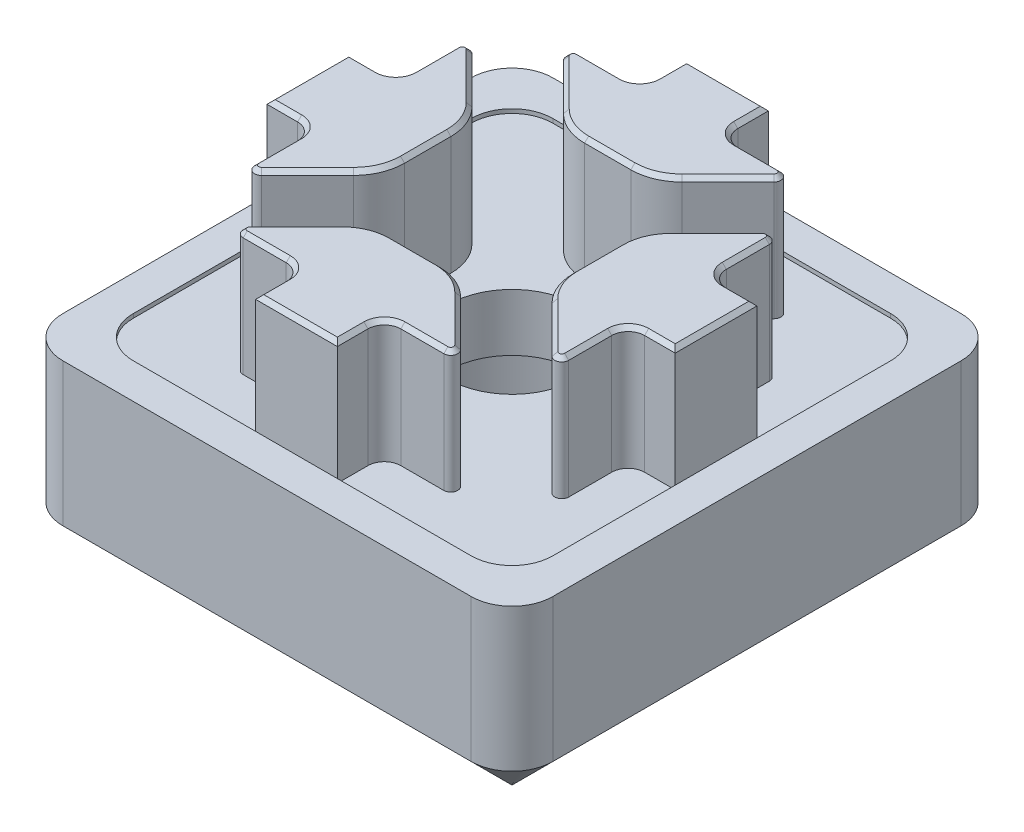
from build123d import *

# Parameters (mm, degrees)
SKETCH1_W           = 24
SKETCH1_H           = 24
SKETCH1_R           = 3.15
BOSS_EXTRUDE1_DEPTH = 9
SKETCH2_W           = 20.55
SKETCH2_H           = 20.55
CUT_EXTRUDE1_DEPTH  = 0.2
SKETCH4_R           = 6
CUT_EXTRUDE2_DEPTH  = 6
FILLET1_R           = 2
CHAMFER1_SIZE       = 2
CHAMFER2_SIZE       = 1
BOSS_EXTRUDE2_DEPTH = 6
CHAMFER3_SIZE       = 0.2


with BuildPart() as part:
    # Sketch1 → Boss-Extrude1 (new body)
    with BuildSketch(Plane(origin=(0, 0, 0), x_dir=(1, 0, 0), z_dir=(0, 1, 0))):
        Rectangle(SKETCH1_W, SKETCH1_H)
        with Locations(Location((0, 0, 0), (0, 0, 270))):
            Circle(SKETCH1_R, mode=Mode.SUBTRACT)
    extrude(amount=BOSS_EXTRUDE1_DEPTH)

    # Sketch2 → Cut-Extrude1 (cut)
    with BuildSketch(Plane(origin=(0, 9, 0), x_dir=(1, 0, 0), z_dir=(0, 1, 0))):
        Rectangle(SKETCH2_W, SKETCH2_H)
    extrude(amount=-CUT_EXTRUDE1_DEPTH, mode=Mode.SUBTRACT)

    # Sketch4 → Cut-Extrude2 (cut)
    with BuildSketch(Plane.XZ):
        with Locations(Location((0, 0, 0), (0, 0, 270))):
            Circle(SKETCH4_R)
    extrude(amount=-CUT_EXTRUDE2_DEPTH, mode=Mode.SUBTRACT)

    # Fillet1
    fillet1_edges = [part.edges().sort_by_distance(p)[0] for p in [
        (-10.275, 8.9, 10.275),
        (-10.275, 8.9, -10.275),
        (10.275, 8.9, -10.275),
        (10.275, 8.9, 10.275),
        (-12, 4.5, -12),
        (12, 4.5, -12),
        (12, 4.5, 12),
        (-12, 4.5, 12),
    ]]
    fillet(fillet1_edges, radius=FILLET1_R)

    # Chamfer1
    chamfer1_edges = [part.edges().sort_by_distance(p)[0] for p in [
        (12, 0, 0),
        (-12, 0, 0),
        (0, 0, -12),
        (0, 0, 12),
        (11.414213562, 0, -11.414213562),
        (-11.414213562, 0, -11.414213562),
        (-11.414213562, 0, 11.414213562),
        (11.414213562, 0, 11.414213562),
    ]]
    chamfer(chamfer1_edges, length=CHAMFER1_SIZE - 0.0001)  # a hair under: the kernel refuses the full size

    # Chamfer2
    chamfer2_edges = [part.edges().sort_by_distance(p)[0] for p in [
        (0, 0, 6),
    ]]
    chamfer(chamfer2_edges, length=CHAMFER2_SIZE)

    # Sketch5 → Boss-Extrude2 (add)
    with BuildSketch(Plane(origin=(0, 8.8, 0), x_dir=(1, 0, 0), z_dir=(0, 1, 0))):
        with BuildLine():
            Line((7.9716, -5.195), (7.9716, -3.0868))
            ThreePointArc((7.9716, -3.0868), (8.207320463, -2.517720463), (8.7764, -2.282))
            Line((8.7764, -2.282), (10.275, -2.282))
            Line((10.275, -2.282), (10.275, 1.7218))
            Line((10.275, 1.7218), (8.7764, 1.7218))
            ThreePointArc((8.7764, 1.7218), (8.207320463, 1.957520463), (7.9716, 2.5266))
            Line((7.9716, 2.5266), (7.9716, 4.6348))
            ThreePointArc((7.9716, 4.6348), (7.762823537, 4.947256058), (7.394256487, 4.873943513))
            Line((7.394256487, 4.873943513), (5.139419138, 2.619106165))
            ThreePointArc((5.139419138, 2.619106165), (4.598094223, 1.808956178), (4.408006192, 0.853319111))
            Line((4.408006192, 0.853319111), (4.408006192, -1.413519111))
            ThreePointArc((4.408006192, -1.413519111), (4.598094223, -2.369156178), (5.139419138, -3.179306165))
            Line((5.139419138, -3.179306165), (7.394256487, -5.434143513))
            ThreePointArc((7.394256487, -5.434143513), (7.762823537, -5.507456058), (7.9716, -5.195))
        make_face()
        with BuildLine():
            Line((1.7218, -10.275), (-2.282, -10.275))
            Line((-2.282, -10.275), (-2.282, -8.7764))
            ThreePointArc((-2.282, -8.7764), (-2.517720463, -8.207320463), (-3.0868, -7.9716))
            Line((-3.0868, -7.9716), (-5.195, -7.9716))
            ThreePointArc((-5.195, -7.9716), (-5.507456058, -7.762823537), (-5.434143513, -7.394256487))
            Line((-5.434143513, -7.394256487), (-3.179306165, -5.139419138))
            ThreePointArc((-3.179306165, -5.139419138), (-2.369156178, -4.598094223), (-1.413519111, -4.408006192))
            Line((-1.413519111, -4.408006192), (0.853319111, -4.408006192))
            ThreePointArc((0.853319111, -4.408006192), (1.808956178, -4.598094223), (2.619106165, -5.139419138))
            Line((2.619106165, -5.139419138), (4.873943513, -7.394256487))
            ThreePointArc((4.873943513, -7.394256487), (4.947256058, -7.762823537), (4.6348, -7.9716))
            Line((4.6348, -7.9716), (2.5266, -7.9716))
            ThreePointArc((2.5266, -7.9716), (1.957520463, -8.207320463), (1.7218, -8.7764))
            Line((1.7218, -8.7764), (1.7218, -10.275))
        make_face()
        with BuildLine():
            Line((-10.275, -1.7218), (-10.275, 2.282))
            Line((-10.275, 2.282), (-8.7764, 2.282))
            ThreePointArc((-8.7764, 2.282), (-8.207320463, 2.517720463), (-7.9716, 3.0868))
            Line((-7.9716, 3.0868), (-7.9716, 5.195))
            ThreePointArc((-7.9716, 5.195), (-7.762823537, 5.507456058), (-7.394256487, 5.434143513))
            Line((-7.394256487, 5.434143513), (-5.139419138, 3.179306165))
            ThreePointArc((-5.139419138, 3.179306165), (-4.598094223, 2.369156178), (-4.408006192, 1.413519111))
            Line((-4.408006192, 1.413519111), (-4.408006192, -0.853319111))
            ThreePointArc((-4.408006192, -0.853319111), (-4.598094223, -1.808956178), (-5.139419138, -2.619106165))
            Line((-5.139419138, -2.619106165), (-7.394256487, -4.873943513))
            ThreePointArc((-7.394256487, -4.873943513), (-7.762823537, -4.947256058), (-7.9716, -4.6348))
            Line((-7.9716, -4.6348), (-7.9716, -2.5266))
            ThreePointArc((-7.9716, -2.5266), (-8.207320463, -1.957520463), (-8.7764, -1.7218))
            Line((-8.7764, -1.7218), (-10.275, -1.7218))
        make_face()
        with BuildLine():
            Line((-1.7218, 10.275), (2.282, 10.275))
            Line((2.282, 10.275), (2.282, 8.7764))
            ThreePointArc((2.282, 8.7764), (2.517720463, 8.207320463), (3.0868, 7.9716))
            Line((3.0868, 7.9716), (5.195, 7.9716))
            ThreePointArc((5.195, 7.9716), (5.507456058, 7.762823537), (5.434143513, 7.394256487))
            Line((5.434143513, 7.394256487), (3.179306165, 5.139419138))
            ThreePointArc((3.179306165, 5.139419138), (2.369156178, 4.598094223), (1.413519111, 4.408006192))
            Line((1.413519111, 4.408006192), (-0.853319111, 4.408006192))
            ThreePointArc((-0.853319111, 4.408006192), (-1.808956178, 4.598094223), (-2.619106165, 5.139419138))
            Line((-2.619106165, 5.139419138), (-4.873943513, 7.394256487))
            ThreePointArc((-4.873943513, 7.394256487), (-4.947256058, 7.762823537), (-4.6348, 7.9716))
            Line((-4.6348, 7.9716), (-2.5266, 7.9716))
            ThreePointArc((-2.5266, 7.9716), (-1.957520463, 8.207320463), (-1.7218, 8.7764))
            Line((-1.7218, 8.7764), (-1.7218, 10.275))
        make_face()
    extrude(amount=BOSS_EXTRUDE2_DEPTH)

    # Chamfer3
    chamfer3_edges = [part.edges().sort_by_distance(p)[0] for p in [
        (-1.957520463, 14.8, -8.207320463),
        (2.517720463, 14.8, -8.207320463),
        (-1.7218, 14.8, -9.5257),
        (-3.5807, 14.8, -7.9716),
        (-4.947256058, 14.8, -7.762823537),
        (-3.746524839, 14.8, -6.266837812),
        (-1.808956178, 14.8, -4.598094223),
        (0.2801, 14.8, -4.408006192),
        (2.369156178, 14.8, -4.598094223),
        (4.306724839, 14.8, -6.266837812),
        (5.507456058, 14.8, -7.762823537),
        (4.1409, 14.8, -7.9716),
        (2.282, 14.8, -9.5257),
        (0.2801, 14.8, -10.275),
        (-8.207320463, 14.8, 1.957520463),
        (-8.207320463, 14.8, -2.517720463),
        (-9.5257, 14.8, 1.7218),
        (-7.9716, 14.8, 3.5807),
        (-7.762823537, 14.8, 4.947256058),
        (-6.266837812, 14.8, 3.746524839),
        (-4.598094223, 14.8, 1.808956178),
        (-4.408006192, 14.8, -0.2801),
        (-4.598094223, 14.8, -2.369156178),
        (-6.266837812, 14.8, -4.306724839),
        (-7.762823537, 14.8, -5.507456058),
        (-7.9716, 14.8, -4.1409),
        (-9.5257, 14.8, -2.282),
        (-10.275, 14.8, -0.2801),
        (1.957520463, 14.8, 8.207320463),
        (-2.517720463, 14.8, 8.207320463),
        (1.7218, 14.8, 9.5257),
        (3.5807, 14.8, 7.9716),
        (4.947256058, 14.8, 7.762823537),
        (3.746524839, 14.8, 6.266837812),
        (1.808956178, 14.8, 4.598094223),
        (-0.2801, 14.8, 4.408006192),
        (-2.369156178, 14.8, 4.598094223),
        (-4.306724839, 14.8, 6.266837812),
        (-5.507456058, 14.8, 7.762823537),
        (-4.1409, 14.8, 7.9716),
        (-2.282, 14.8, 9.5257),
        (-0.2801, 14.8, 10.275),
        (8.207320463, 14.8, -1.957520463),
        (8.207320463, 14.8, 2.517720463),
        (9.5257, 14.8, -1.7218),
        (7.9716, 14.8, -3.5807),
        (7.762823537, 14.8, -4.947256058),
        (6.266837812, 14.8, -3.746524839),
        (4.598094223, 14.8, -1.808956178),
        (4.408006192, 14.8, 0.2801),
        (4.598094223, 14.8, 2.369156178),
        (6.266837812, 14.8, 4.306724839),
        (7.762823537, 14.8, 5.507456058),
        (7.9716, 14.8, 4.1409),
        (9.5257, 14.8, 2.282),
        (10.275, 14.8, 0.2801),
    ]]
    chamfer(chamfer3_edges, length=CHAMFER3_SIZE)


solid = part.part
